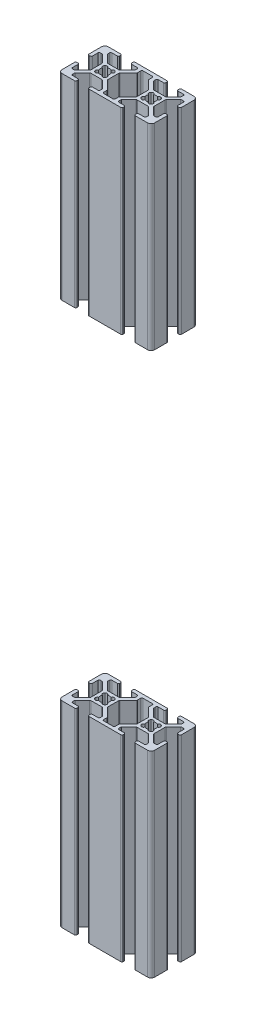
from build123d import *

# Parameters (mm, degrees)
EXTRUDE_1_DEPTH     = 160
SKETCH_2_W          = 40
SKETCH_2_H          = 150
CUT_EXTRUDE_1_DEPTH = 32


with BuildPart() as part:
    # 草图1 → 凸台-拉伸1 (new, symmetric)
    with BuildSketch(Plane(origin=(0, 0, 0), x_dir=(1, 0, 0), z_dir=(0, 1, 0))):
        with BuildLine():
            Line((-3.011929568, 5.856870214), (1.755909109, 5.856870214))
            ThreePointArc((1.755909109, 5.856870214), (1.950312292, 5.818201017), (2.115119353, 5.708080459))
            Line((2.115119353, 5.708080459), (5.218200015, 2.604999798))
            ThreePointArc((5.218200015, 2.604999798), (5.328320573, 2.440192737), (5.36698977, 2.245789553))
            Line((5.36698977, 2.245789553), (5.36698977, 1.519870214))
            ThreePointArc((5.36698977, 1.519870214), (5.218200015, 1.16065997), (4.85898977, 1.011870214))
            Line((4.85898977, 1.011870214), (2.50998977, 1.011870214))
            ThreePointArc((2.50998977, 1.011870214), (2.150779525, 0.863080459), (2.00198977, 0.503870214))
            Line((2.00198977, 0.503870214), (2.00198977, 0.019870214))
            ThreePointArc((2.00198977, 0.019870214), (2.150779525, -0.33934003), (2.50998977, -0.488129786))
            Line((2.50998977, -0.488129786), (16.23398977, -0.488129786))
            ThreePointArc((16.23398977, -0.488129786), (16.593200015, -0.33934003), (16.74198977, 0.019870214))
            Line((16.74198977, 0.019870214), (16.74198977, 0.503870214))
            ThreePointArc((16.74198977, 0.503870214), (16.593200015, 0.863080459), (16.23398977, 1.011870214))
            Line((16.23398977, 1.011870214), (13.88498977, 1.011870214))
            ThreePointArc((13.88498977, 1.011870214), (13.525779525, 1.16065997), (13.37698977, 1.519870214))
            Line((13.37698977, 1.519870214), (13.37698977, 2.245789553))
            ThreePointArc((13.37698977, 2.245789553), (13.415658968, 2.440192737), (13.525779525, 2.604999798))
            Line((13.525779525, 2.604999798), (16.628860187, 5.708080459))
            ThreePointArc((16.628860187, 5.708080459), (16.793667248, 5.818201017), (16.988070432, 5.856870214))
            Line((16.988070432, 5.856870214), (21.755909109, 5.856870214))
            ThreePointArc((21.755909109, 5.856870214), (21.950312292, 5.818201017), (22.115119353, 5.708080459))
            Line((22.115119353, 5.708080459), (25.218200015, 2.604999798))
            ThreePointArc((25.218200015, 2.604999798), (25.328320573, 2.440192737), (25.36698977, 2.245789553))
            Line((25.36698977, 2.245789553), (25.36698977, 1.519870214))
            ThreePointArc((25.36698977, 1.519870214), (25.218200015, 1.16065997), (24.85898977, 1.011870214))
            Line((24.85898977, 1.011870214), (22.50998977, 1.011870214))
            ThreePointArc((22.50998977, 1.011870214), (22.150779525, 0.863080459), (22.00198977, 0.503870214))
            Line((22.00198977, 0.503870214), (22.00198977, 0.019870214))
            ThreePointArc((22.00198977, 0.019870214), (22.150779525, -0.33934003), (22.50998977, -0.488129786))
            Line((22.50998977, -0.488129786), (27.87198977, -0.488129786))
            ThreePointArc((27.87198977, -0.488129786), (28.932649942, -0.048789957), (29.37198977, 1.011870214))
            Line((29.37198977, 1.011870214), (29.37198977, 6.373870214))
            ThreePointArc((29.37198977, 6.373870214), (29.223200015, 6.733080459), (28.86398977, 6.881870214))
            Line((28.86398977, 6.881870214), (28.37998977, 6.881870214))
            ThreePointArc((28.37998977, 6.881870214), (28.020779525, 6.733080459), (27.87198977, 6.373870214))
            Line((27.87198977, 6.373870214), (27.87198977, 4.024870214))
            ThreePointArc((27.87198977, 4.024870214), (27.723200015, 3.66565997), (27.36398977, 3.516870214))
            Line((27.36398977, 3.516870214), (26.638070432, 3.516870214))
            ThreePointArc((26.638070432, 3.516870214), (26.443667248, 3.555539412), (26.278860187, 3.66565997))
            Line((26.278860187, 3.66565997), (23.175779525, 6.768740631))
            ThreePointArc((23.175779525, 6.768740631), (23.065658968, 6.933547692), (23.02698977, 7.127950876))
            Line((23.02698977, 7.127950876), (23.02698977, 11.895789553))
            ThreePointArc((23.02698977, 11.895789553), (23.065658968, 12.090192737), (23.175779525, 12.254999798))
            Line((23.175779525, 12.254999798), (26.278860187, 15.358080459))
            ThreePointArc((26.278860187, 15.358080459), (26.443667248, 15.468201017), (26.638070432, 15.506870214))
            Line((26.638070432, 15.506870214), (27.36398977, 15.506870214))
            ThreePointArc((27.36398977, 15.506870214), (27.723200015, 15.358080459), (27.87198977, 14.998870214))
            Line((27.87198977, 14.998870214), (27.87198977, 12.649870214))
            ThreePointArc((27.87198977, 12.649870214), (28.020779525, 12.29065997), (28.37998977, 12.141870214))
            Line((28.37998977, 12.141870214), (28.86398977, 12.141870214))
            ThreePointArc((28.86398977, 12.141870214), (29.223200015, 12.29065997), (29.37198977, 12.649870214))
            Line((29.37198977, 12.649870214), (29.37198977, 18.011870214))
            ThreePointArc((29.37198977, 18.011870214), (28.932649942, 19.072530386), (27.87198977, 19.511870214))
            Line((27.87198977, 19.511870214), (22.50998977, 19.511870214))
            ThreePointArc((22.50998977, 19.511870214), (22.150779525, 19.363080459), (22.00198977, 19.003870214))
            Line((22.00198977, 19.003870214), (22.00198977, 18.519870214))
            ThreePointArc((22.00198977, 18.519870214), (22.150779525, 18.16065997), (22.50998977, 18.011870214))
            Line((22.50998977, 18.011870214), (24.85898977, 18.011870214))
            ThreePointArc((24.85898977, 18.011870214), (25.218200015, 17.863080459), (25.36698977, 17.503870214))
            Line((25.36698977, 17.503870214), (25.36698977, 16.777950876))
            ThreePointArc((25.36698977, 16.777950876), (25.328320573, 16.583547692), (25.218200015, 16.418740631))
            Line((25.218200015, 16.418740631), (22.115119353, 13.31565997))
            ThreePointArc((22.115119353, 13.31565997), (21.950312292, 13.205539412), (21.755909109, 13.166870214))
            Line((21.755909109, 13.166870214), (16.988070432, 13.166870214))
            ThreePointArc((16.988070432, 13.166870214), (16.793667248, 13.205539412), (16.628860187, 13.31565997))
            Line((16.628860187, 13.31565997), (13.525779525, 16.418740631))
            ThreePointArc((13.525779525, 16.418740631), (13.415658968, 16.583547692), (13.37698977, 16.777950876))
            Line((13.37698977, 16.777950876), (13.37698977, 17.503870214))
            ThreePointArc((13.37698977, 17.503870214), (13.525779525, 17.863080459), (13.88498977, 18.011870214))
            Line((13.88498977, 18.011870214), (16.23398977, 18.011870214))
            ThreePointArc((16.23398977, 18.011870214), (16.593200015, 18.16065997), (16.74198977, 18.519870214))
            Line((16.74198977, 18.519870214), (16.74198977, 19.003870214))
            ThreePointArc((16.74198977, 19.003870214), (16.593200015, 19.363080459), (16.23398977, 19.511870214))
            Line((16.23398977, 19.511870214), (2.50998977, 19.511870214))
            ThreePointArc((2.50998977, 19.511870214), (2.150779525, 19.363080459), (2.00198977, 19.003870214))
            Line((2.00198977, 19.003870214), (2.00198977, 18.519870214))
            ThreePointArc((2.00198977, 18.519870214), (2.150779525, 18.16065997), (2.50998977, 18.011870214))
            Line((2.50998977, 18.011870214), (4.85898977, 18.011870214))
            ThreePointArc((4.85898977, 18.011870214), (5.218200015, 17.863080459), (5.36698977, 17.503870214))
            Line((5.36698977, 17.503870214), (5.36698977, 16.777950876))
            ThreePointArc((5.36698977, 16.777950876), (5.328320573, 16.583547692), (5.218200015, 16.418740631))
            Line((5.218200015, 16.418740631), (2.115119353, 13.31565997))
            ThreePointArc((2.115119353, 13.31565997), (1.950312292, 13.205539412), (1.755909109, 13.166870214))
            Line((1.755909109, 13.166870214), (-3.011929568, 13.166870214))
            ThreePointArc((-3.011929568, 13.166870214), (-3.206332752, 13.205539412), (-3.371139813, 13.31565997))
            Line((-3.371139813, 13.31565997), (-6.474220475, 16.418740631))
            ThreePointArc((-6.474220475, 16.418740631), (-6.584341032, 16.583547692), (-6.62301023, 16.777950876))
            Line((-6.62301023, 16.777950876), (-6.62301023, 17.503870214))
            ThreePointArc((-6.62301023, 17.503870214), (-6.474220475, 17.863080459), (-6.11501023, 18.011870214))
            Line((-6.11501023, 18.011870214), (-3.76601023, 18.011870214))
            ThreePointArc((-3.76601023, 18.011870214), (-3.406799985, 18.16065997), (-3.25801023, 18.519870214))
            Line((-3.25801023, 18.519870214), (-3.25801023, 19.003870214))
            ThreePointArc((-3.25801023, 19.003870214), (-3.406799985, 19.363080459), (-3.76601023, 19.511870214))
            Line((-3.76601023, 19.511870214), (-9.12801023, 19.511870214))
            ThreePointArc((-9.12801023, 19.511870214), (-10.188670402, 19.072530386), (-10.62801023, 18.011870214))
            Line((-10.62801023, 18.011870214), (-10.62801023, 12.649870214))
            ThreePointArc((-10.62801023, 12.649870214), (-10.479220475, 12.29065997), (-10.12001023, 12.141870214))
            Line((-10.12001023, 12.141870214), (-9.63601023, 12.141870214))
            ThreePointArc((-9.63601023, 12.141870214), (-9.276799985, 12.29065997), (-9.12801023, 12.649870214))
            Line((-9.12801023, 12.649870214), (-9.12801023, 14.998870214))
            ThreePointArc((-9.12801023, 14.998870214), (-8.979220475, 15.358080459), (-8.62001023, 15.506870214))
            Line((-8.62001023, 15.506870214), (-7.894090891, 15.506870214))
            ThreePointArc((-7.894090891, 15.506870214), (-7.699687708, 15.468201017), (-7.534880647, 15.358080459))
            Line((-7.534880647, 15.358080459), (-4.431799985, 12.254999798))
            ThreePointArc((-4.431799985, 12.254999798), (-4.321679427, 12.090192737), (-4.28301023, 11.895789553))
            Line((-4.28301023, 11.895789553), (-4.28301023, 7.127950876))
            ThreePointArc((-4.28301023, 7.127950876), (-4.321679427, 6.933547692), (-4.431799985, 6.768740631))
            Line((-4.431799985, 6.768740631), (-7.534880647, 3.66565997))
            ThreePointArc((-7.534880647, 3.66565997), (-7.699687708, 3.555539412), (-7.894090891, 3.516870214))
            Line((-7.894090891, 3.516870214), (-8.62001023, 3.516870214))
            ThreePointArc((-8.62001023, 3.516870214), (-8.979220475, 3.66565997), (-9.12801023, 4.024870214))
            Line((-9.12801023, 4.024870214), (-9.12801023, 6.373870214))
            ThreePointArc((-9.12801023, 6.373870214), (-9.276799985, 6.733080459), (-9.63601023, 6.881870214))
            Line((-9.63601023, 6.881870214), (-10.12001023, 6.881870214))
            ThreePointArc((-10.12001023, 6.881870214), (-10.479220475, 6.733080459), (-10.62801023, 6.373870214))
            Line((-10.62801023, 6.373870214), (-10.62801023, 1.011870214))
            ThreePointArc((-10.62801023, 1.011870214), (-10.188670402, -0.048789957), (-9.12801023, -0.488129786))
            Line((-9.12801023, -0.488129786), (-3.76601023, -0.488129786))
            ThreePointArc((-3.76601023, -0.488129786), (-3.406799985, -0.33934003), (-3.25801023, 0.019870214))
            Line((-3.25801023, 0.019870214), (-3.25801023, 0.503870214))
            ThreePointArc((-3.25801023, 0.503870214), (-3.406799985, 0.863080459), (-3.76601023, 1.011870214))
            Line((-3.76601023, 1.011870214), (-6.11501023, 1.011870214))
            ThreePointArc((-6.11501023, 1.011870214), (-6.474220475, 1.16065997), (-6.62301023, 1.519870214))
            Line((-6.62301023, 1.519870214), (-6.62301023, 2.245789553))
            ThreePointArc((-6.62301023, 2.245789553), (-6.584341032, 2.440192737), (-6.474220475, 2.604999798))
            Line((-6.474220475, 2.604999798), (-3.371139813, 5.708080459))
            ThreePointArc((-3.371139813, 5.708080459), (-3.206332752, 5.818201017), (-3.011929568, 5.856870214))
        make_face()
        with BuildLine():
            Line((17.247088926, 7.207364248), (17.067483804, 7.386969371))
            ThreePointArc((17.067483804, 7.386969371), (16.866051753, 8.155402404), (17.436856264, 8.707893496))
            ThreePointArc((17.436856264, 8.707893496), (17.27648977, 9.511870214), (17.436856264, 10.315846932))
            ThreePointArc((17.436856264, 10.315846932), (16.866051753, 10.868338025), (17.067483804, 11.636771058))
            Line((17.067483804, 11.636771058), (17.247088926, 11.816376181))
            ThreePointArc((17.247088926, 11.816376181), (18.015521959, 12.017808231), (18.568013052, 11.447003721))
            ThreePointArc((18.568013052, 11.447003721), (19.37198977, 11.607370214), (20.175966488, 11.447003721))
            ThreePointArc((20.175966488, 11.447003721), (20.728457581, 12.017808231), (21.496890614, 11.816376181))
            Line((21.496890614, 11.816376181), (21.676495736, 11.636771058))
            ThreePointArc((21.676495736, 11.636771058), (21.877927787, 10.868338025), (21.307123276, 10.315846932))
            ThreePointArc((21.307123276, 10.315846932), (21.46748977, 9.511870214), (21.307123276, 8.707893496))
            ThreePointArc((21.307123276, 8.707893496), (21.877927787, 8.155402404), (21.676495736, 7.386969371))
            Line((21.676495736, 7.386969371), (21.496890614, 7.207364248))
            ThreePointArc((21.496890614, 7.207364248), (20.728457581, 7.005932198), (20.175966488, 7.576736708))
            ThreePointArc((20.175966488, 7.576736708), (19.37198977, 7.416370214), (18.568013052, 7.576736708))
            ThreePointArc((18.568013052, 7.576736708), (18.015521959, 7.005932198), (17.247088926, 7.207364248))
        make_face(mode=Mode.SUBTRACT)
        with BuildLine():
            Line((6.86698977, 1.519870214), (6.86698977, 2.867109897))
            ThreePointArc((6.86698977, 2.867109897), (6.828320573, 3.06151308), (6.718200015, 3.226320141))
            Line((6.718200015, 3.226320141), (3.175779525, 6.768740631))
            ThreePointArc((3.175779525, 6.768740631), (3.065658968, 6.933547692), (3.02698977, 7.127950876))
            Line((3.02698977, 7.127950876), (3.02698977, 11.895789553))
            ThreePointArc((3.02698977, 11.895789553), (3.065658968, 12.090192737), (3.175779525, 12.254999798))
            Line((3.175779525, 12.254999798), (6.718200015, 15.797420287))
            ThreePointArc((6.718200015, 15.797420287), (6.828320573, 15.962227349), (6.86698977, 16.156630532))
            Line((6.86698977, 16.156630532), (6.86698977, 17.503870214))
            ThreePointArc((6.86698977, 17.503870214), (7.015779525, 17.863080459), (7.37498977, 18.011870214))
            Line((7.37498977, 18.011870214), (11.36898977, 18.011870214))
            ThreePointArc((11.36898977, 18.011870214), (11.728200015, 17.863080459), (11.87698977, 17.503870214))
            Line((11.87698977, 17.503870214), (11.87698977, 16.156630532))
            ThreePointArc((11.87698977, 16.156630532), (11.915658968, 15.962227349), (12.025779525, 15.797420287))
            Line((12.025779525, 15.797420287), (15.568200015, 12.254999798))
            ThreePointArc((15.568200015, 12.254999798), (15.678320573, 12.090192737), (15.71698977, 11.895789553))
            Line((15.71698977, 11.895789553), (15.71698977, 7.127950876))
            ThreePointArc((15.71698977, 7.127950876), (15.678320573, 6.933547692), (15.568200015, 6.768740631))
            Line((15.568200015, 6.768740631), (12.025779525, 3.226320141))
            ThreePointArc((12.025779525, 3.226320141), (11.915658968, 3.06151308), (11.87698977, 2.867109897))
            Line((11.87698977, 2.867109897), (11.87698977, 1.519870214))
            ThreePointArc((11.87698977, 1.519870214), (11.728200015, 1.16065997), (11.36898977, 1.011870214))
            Line((11.36898977, 1.011870214), (7.37498977, 1.011870214))
            ThreePointArc((7.37498977, 1.011870214), (7.015779525, 1.16065997), (6.86698977, 1.519870214))
        make_face(mode=Mode.SUBTRACT)
        with BuildLine():
            Line((-2.752911074, 7.207364248), (-2.932516196, 7.386969371))
            ThreePointArc((-2.932516196, 7.386969371), (-3.133948247, 8.155402404), (-2.563143736, 8.707893496))
            ThreePointArc((-2.563143736, 8.707893496), (-2.72351023, 9.511870214), (-2.563143736, 10.315846932))
            ThreePointArc((-2.563143736, 10.315846932), (-3.133948247, 10.868338025), (-2.932516196, 11.636771058))
            Line((-2.932516196, 11.636771058), (-2.752911074, 11.816376181))
            ThreePointArc((-2.752911074, 11.816376181), (-1.984478041, 12.017808231), (-1.431986948, 11.447003721))
            ThreePointArc((-1.431986948, 11.447003721), (-0.62801023, 11.607370214), (0.175966488, 11.447003721))
            ThreePointArc((0.175966488, 11.447003721), (0.728457581, 12.017808231), (1.496890614, 11.816376181))
            Line((1.496890614, 11.816376181), (1.676495736, 11.636771058))
            ThreePointArc((1.676495736, 11.636771058), (1.877927787, 10.868338025), (1.307123276, 10.315846932))
            ThreePointArc((1.307123276, 10.315846932), (1.46748977, 9.511870214), (1.307123276, 8.707893496))
            ThreePointArc((1.307123276, 8.707893496), (1.877927787, 8.155402404), (1.676495736, 7.386969371))
            Line((1.676495736, 7.386969371), (1.496890614, 7.207364248))
            ThreePointArc((1.496890614, 7.207364248), (0.728457581, 7.005932198), (0.175966488, 7.576736708))
            ThreePointArc((0.175966488, 7.576736708), (-0.62801023, 7.416370214), (-1.431986948, 7.576736708))
            ThreePointArc((-1.431986948, 7.576736708), (-1.984478041, 7.005932198), (-2.752911074, 7.207364248))
        make_face(mode=Mode.SUBTRACT)
    extrude(amount=EXTRUDE_1_DEPTH, both=True)

    # 草图2 → 切除-拉伸1 (cut)
    with BuildSketch(Plane(origin=(0, 0, -19.511870214), x_dir=(-1, 0, 0), z_dir=(0, 0, -1))):
        with Locations((-9.37198977, 0)):
            Rectangle(SKETCH_2_W, SKETCH_2_H)
    extrude(amount=-CUT_EXTRUDE_1_DEPTH, mode=Mode.SUBTRACT)


with BuildPart() as cut_extrude_1_piece_1:
    # of the separate pieces the step leaves, piece 1, a body of its own (cut_extrude_1_pieces)
    add(part.part.solids().sort_by_distance((-3.76601023, 160, -18.011870214))[0])


with BuildPart() as cut_extrude_1_piece_2:
    # of the separate pieces the step leaves, piece 2, a body of its own (cut_extrude_1_pieces)
    add(part.part.solids().sort_by_distance((-3.76601023, -75, -18.011870214))[0])


solid = Compound([cut_extrude_1_piece_1.part, cut_extrude_1_piece_2.part])
